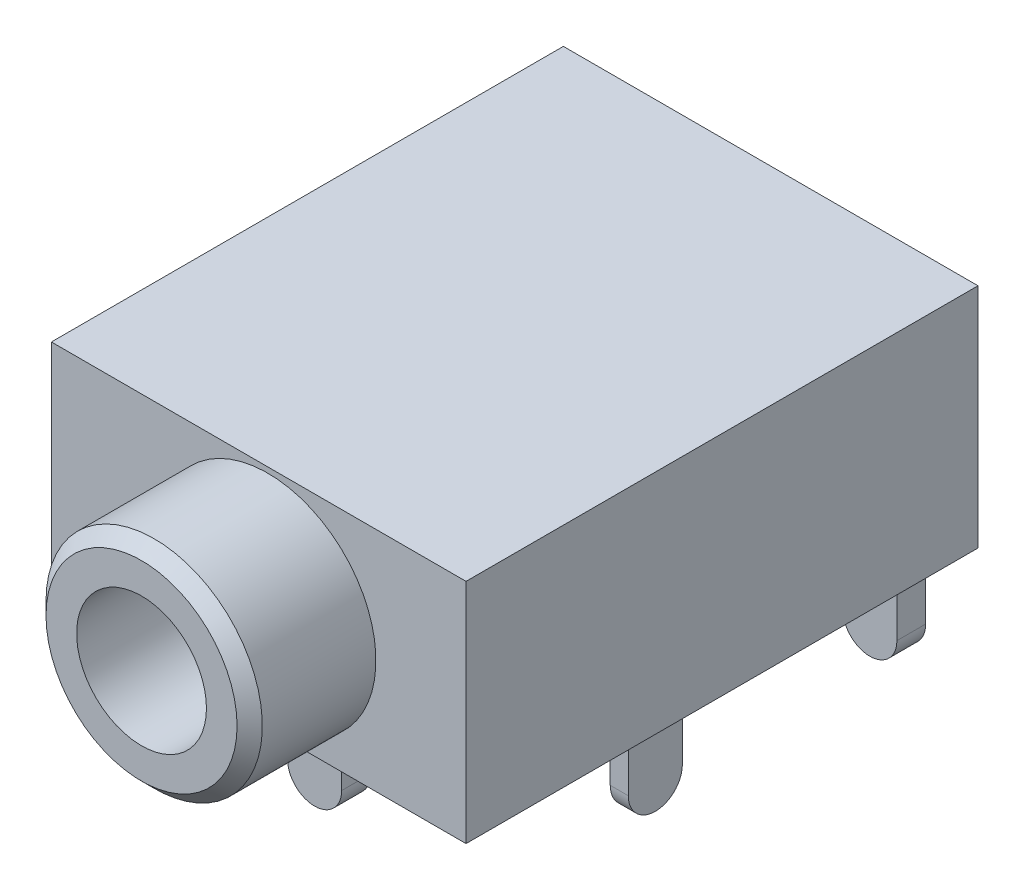
from build123d import *

# Parameters (mm, degrees)
SKETCH1_W             = 11.5
SKETCH1_H             = 14.2
BOSS_EXTRUDE1_DEPTH   = 6.3
SKETCH2_R             = 3
SKETCH2_R_2           = 1.8
BOSS_EXTRUDE2_DEPTH   = 3.5
SKETCH3_W             = 1.5
SKETCH3_H             = 0.8
BOSS_EXTRUDE3_DEPTH   = 2.5
SKETCH3_W_2           = 0.8
SKETCH3_H_2           = 1.5
BOSS_EXTRUDE3_2_DEPTH = 2.5
SKETCH3_W_3           = 0.5
BOSS_EXTRUDE3_3_DEPTH = 2.5
BOSS_EXTRUDE3_4_DEPTH = 2.5
BOSS_EXTRUDE3_5_DEPTH = 2.5
FILLET1_R             = 0.75
FILLET2_R             = 0.75
FILLET3_R             = 0.75
FILLET4_R             = 0.75
FILLET5_R             = 0.75
CHAMFER1_SIZE         = 0.35


with BuildPart() as part:
    # Sketch1 → Boss-Extrude1 (new body)
    with BuildSketch(Plane(origin=(0, 0, 0), x_dir=(1, 0, 0), z_dir=(0, 1, 0))):
        with Locations((5.75, 7.1)):
            Rectangle(SKETCH1_W, SKETCH1_H)
    extrude(amount=BOSS_EXTRUDE1_DEPTH)

    # Sketch2 → Boss-Extrude2 (add)
    with BuildSketch(Plane.XY):
        with Locations(Location((6, 3.15, 0), (0, 0, 180))):
            Circle(SKETCH2_R)
        with Locations((6, 3.15)):
            Circle(SKETCH2_R_2, mode=Mode.SUBTRACT)
    extrude(amount=BOSS_EXTRUDE2_DEPTH)

    # Chamfer1
    chamfer1_edges = [part.edges().sort_by_distance(p)[0] for p in [
        (9, 3.15, 3.5),
    ]]
    chamfer(chamfer1_edges, length=CHAMFER1_SIZE)


with BuildPart() as body_2:
    # Sketch3 → Boss-Extrude3 (new body)
    with BuildSketch(Plane.XZ):
        with Locations((6, -1.7)):
            Rectangle(SKETCH3_W, SKETCH3_H)
    extrude(amount=BOSS_EXTRUDE3_DEPTH)

    # Fillet1
    fillet1_edges = [body_2.edges().sort_by_distance(p)[0] for p in [
        (6.75, -2.5, -1.7),
        (5.25, -2.5, -1.7),
    ]]
    fillet(fillet1_edges, radius=FILLET1_R - 0.0001)  # a hair under: the kernel refuses the full size


with BuildPart() as body_3:
    # Sketch3 → Boss-Extrude3 2 (new body)
    with BuildSketch(Plane.XZ):
        with Locations((3.4, -8.6)):
            Rectangle(SKETCH3_W_2, SKETCH3_H_2)
    extrude(amount=BOSS_EXTRUDE3_2_DEPTH)

    # Fillet3
    fillet3_edges = [body_3.edges().sort_by_distance(p)[0] for p in [
        (3.4, -2.5, -9.35),
        (3.4, -2.5, -7.85),
    ]]
    fillet(fillet3_edges, radius=FILLET3_R - 0.0001)  # a hair under: the kernel refuses the full size


with BuildPart() as body_4:
    # Sketch3 → Boss-Extrude3 3 (new body)
    with BuildSketch(Plane.XZ):
        with Locations((0.8, -9.6)):
            Rectangle(SKETCH3_W_3, SKETCH3_H_2)
    extrude(amount=BOSS_EXTRUDE3_3_DEPTH)

    # Fillet4
    fillet4_edges = [body_4.edges().sort_by_distance(p)[0] for p in [
        (0.8, -2.5, -10.35),
        (0.8, -2.5, -8.85),
    ]]
    fillet(fillet4_edges, radius=FILLET4_R - 0.0001)  # a hair under: the kernel refuses the full size


with BuildPart() as body_5:
    # Sketch3 → Boss-Extrude3 4 (new body)
    with BuildSketch(Plane.XZ):
        with Locations((10.6, -5.9)):
            Rectangle(SKETCH3_W_3, SKETCH3_H_2)
    extrude(amount=BOSS_EXTRUDE3_4_DEPTH)

    # Fillet2
    fillet2_edges = [body_5.edges().sort_by_distance(p)[0] for p in [
        (10.6, -2.5, -6.65),
        (10.6, -2.5, -5.15),
    ]]
    fillet(fillet2_edges, radius=FILLET2_R - 0.0001)  # a hair under: the kernel refuses the full size


with BuildPart() as body_6:
    # Sketch3 → Boss-Extrude3 5 (new body)
    with BuildSketch(Plane.XZ):
        with Locations((10.1, -13)):
            Rectangle(SKETCH3_W, SKETCH3_H)
    extrude(amount=BOSS_EXTRUDE3_5_DEPTH)

    # Fillet5
    fillet5_edges = [body_6.edges().sort_by_distance(p)[0] for p in [
        (10.85, -2.5, -13),
        (9.35, -2.5, -13),
    ]]
    fillet(fillet5_edges, radius=FILLET5_R - 0.0001)  # a hair under: the kernel refuses the full size


solid = Compound([part.part, body_2.part, body_3.part, body_4.part, body_5.part, body_6.part])
